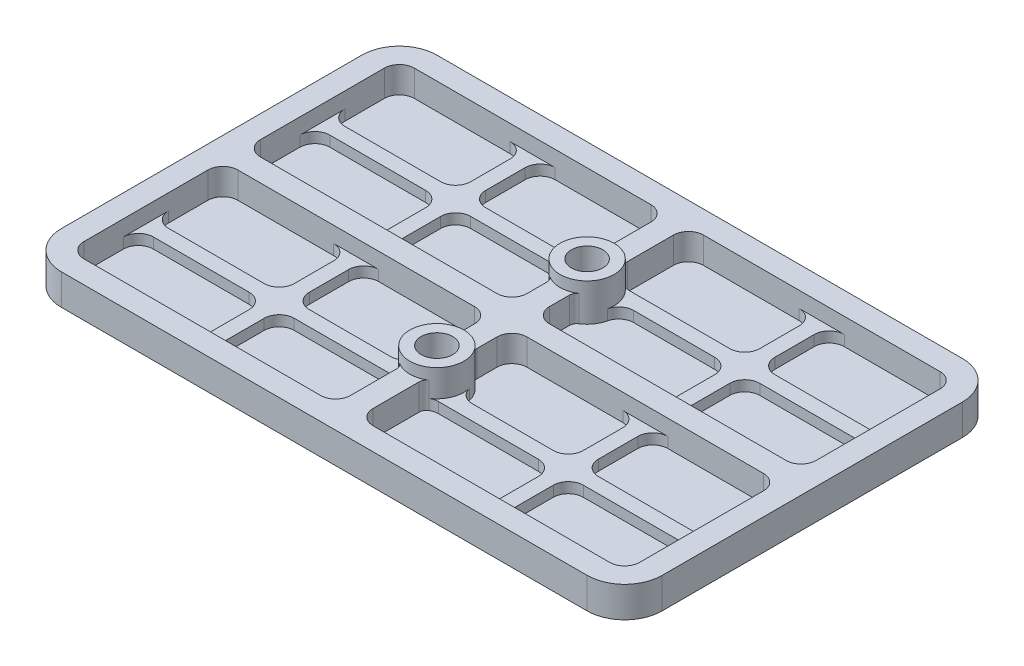
from build123d import *

# Parameters (mm, degrees)
SKETCH1_W           = 80
SKETCH1_H           = 50
BOSS_EXTRUDE1_DEPTH = 0.6
SKETCH2_W           = 80
SKETCH2_H           = 50
SKETCH2_W_2         = 35.5
SKETCH2_H_2         = 20.5
BOSS_EXTRUDE2_DEPTH = 3.5
FILLET1_R           = 2
FILLET2_R           = 5
BOSS_EXTRUDE3_DEPTH = 3.5
SKETCH5_R           = 2.1
CUT_EXTRUDE1_DEPTH  = 5
BOSS_EXTRUDE4_START = 1.5
SKETCH6_R           = 3.6
SKETCH6_R_2         = 2.1
BOSS_EXTRUDE4_DEPTH = 1.5
BOSS_EXTRUDE5_START = 1.4
BOSS_EXTRUDE5_DEPTH = 1.4
FILLET3_DEPTH       = 2
BOSS_EXTRUDE6_START = -0.2
SKETCH8_R           = 2.1
BOSS_EXTRUDE6_DEPTH = 0.2


with BuildPart() as part:
    # Sketch1 → Boss-Extrude1 (new body)
    with BuildSketch(Plane(origin=(0, 0, 0), x_dir=(1, 0, 0), z_dir=(0, 1, 0))):
        Rectangle(SKETCH1_W, SKETCH1_H)
    extrude(amount=BOSS_EXTRUDE1_DEPTH)

    # Sketch2 → Boss-Extrude2 (add)
    with BuildSketch(Plane(origin=(0, 0.6, 0), x_dir=(1, 0, 0), z_dir=(0, 1, 0))):
        Rectangle(SKETCH2_W, SKETCH2_H)
        with Locations((-19.25, 11.75)):
            Rectangle(SKETCH2_W_2, SKETCH2_H_2, mode=Mode.SUBTRACT)
        with Locations((19.25, 11.75)):
            Rectangle(SKETCH2_W_2, SKETCH2_H_2, mode=Mode.SUBTRACT)
        with Locations((19.25, -11.75)):
            Rectangle(SKETCH2_W_2, SKETCH2_H_2, mode=Mode.SUBTRACT)
        with Locations((-19.25, -11.75)):
            Rectangle(SKETCH2_W_2, SKETCH2_H_2, mode=Mode.SUBTRACT)
    extrude(amount=BOSS_EXTRUDE2_DEPTH)

    # Fillet1
    fillet1_edges = [part.edges().sort_by_distance(p)[0] for p in [
        (-37, 2.35, -1.5),
        (-1.5, 2.35, -1.5),
        (-1.5, 2.35, -22),
        (-37, 2.35, -22),
        (1.5, 2.35, -1.5),
        (37, 2.35, -1.5),
        (37, 2.35, -22),
        (1.5, 2.35, -22),
        (37, 2.35, 1.5),
        (1.5, 2.35, 1.5),
        (1.5, 2.35, 22),
        (37, 2.35, 22),
        (-1.5, 2.35, 1.5),
        (-37, 2.35, 1.5),
        (-37, 2.35, 22),
        (-1.5, 2.35, 22),
    ]]
    fillet(fillet1_edges, radius=FILLET1_R)

    # Fillet2
    fillet2_edges = [part.edges().sort_by_distance(p)[0] for p in [
        (-40, 2.05, -25),
        (40, 2.05, -25),
        (40, 2.05, 25),
        (-40, 2.05, 25),
    ]]
    fillet(fillet2_edges, radius=FILLET2_R)

    # Sketch4 → Boss-Extrude3 (add)
    with BuildSketch(Plane(origin=(0, 4.1, 0), x_dir=(1, 0, 0), z_dir=(0, 1, 0))):
        with BuildLine():
            Line((-1.5, 13.861346915), (-1.5, 6.138653085))
            ThreePointArc((-1.5, 6.138653085), (-1.621513159, 6.616419628), (-1.956521739, 6.978076327))
            ThreePointArc((-1.956521739, 6.978076327), (-3.6, 10), (-1.956521739, 13.021923673))
            ThreePointArc((-1.956521739, 13.021923673), (-1.621513159, 13.383580372), (-1.5, 13.861346915))
        make_face()
        with BuildLine():
            Line((1.5, 13.861346915), (1.5, 6.138653085))
            ThreePointArc((1.5, 6.138653085), (1.621513159, 6.616419628), (1.956521739, 6.978076327))
            ThreePointArc((1.956521739, 6.978076327), (3.6, 10), (1.956521739, 13.021923673))
            ThreePointArc((1.956521739, 13.021923673), (1.621513159, 13.383580372), (1.5, 13.861346915))
        make_face()
        with BuildLine():
            Line((1.5, -13.861346915), (1.5, -6.138653085))
            ThreePointArc((1.5, -6.138653085), (1.621513159, -6.616419628), (1.956521739, -6.978076327))
            ThreePointArc((1.956521739, -6.978076327), (3.6, -10), (1.956521739, -13.021923673))
            ThreePointArc((1.956521739, -13.021923673), (1.621513159, -13.383580372), (1.5, -13.861346915))
        make_face()
        with BuildLine():
            Line((-1.5, -13.861346915), (-1.5, -6.138653085))
            ThreePointArc((-1.5, -6.138653085), (-1.621513159, -6.616419628), (-1.956521739, -6.978076327))
            ThreePointArc((-1.956521739, -6.978076327), (-3.6, -10), (-1.956521739, -13.021923673))
            ThreePointArc((-1.956521739, -13.021923673), (-1.621513159, -13.383580372), (-1.5, -13.861346915))
        make_face()
    extrude(amount=-BOSS_EXTRUDE3_DEPTH)

    # Sketch5 → Cut-Extrude1 (cut)
    with BuildSketch(Plane(origin=(0, 4.1, 0), x_dir=(1, 0, 0), z_dir=(0, 1, 0))):
        with Locations(Location((0, 10, 0), (0, 0, 270))):
            Circle(SKETCH5_R)
        with Locations(Location((0, -10, 0), (0, 0, 270))):
            Circle(SKETCH5_R)
    extrude(amount=-CUT_EXTRUDE1_DEPTH, mode=Mode.SUBTRACT)

    # Sketch6 → Boss-Extrude4 (add)
    # profile 1 of 2: a face of its own
    with BuildSketch(Plane(origin=(0, 4.1, 0), x_dir=(1, 0, 0), z_dir=(0, 1, 0)).offset(BOSS_EXTRUDE4_START)):
        with Locations(Location((0, 10, 0), (0, 0, 270))):
            Circle(SKETCH6_R)
        with Locations(Location((0, 10, 0), (0, 0, 270))):
            Circle(SKETCH6_R_2, mode=Mode.SUBTRACT)
    # profile 2 of 2: a face of its own
    with BuildSketch(Plane(origin=(0, 4.1, 0), x_dir=(1, 0, 0), z_dir=(0, 1, 0)).offset(BOSS_EXTRUDE4_START)):
        with Locations(Location((0, -10, 0), (0, 0, 270))):
            Circle(SKETCH6_R)
        with Locations(Location((0, -10, 0), (0, 0, 270))):
            Circle(SKETCH6_R_2, mode=Mode.SUBTRACT)
    extrude(amount=-BOSS_EXTRUDE4_DEPTH)

    # Sketch7 → Boss-Extrude5 (add)
    with BuildSketch(Plane(origin=(0, 0.6, 0), x_dir=(1, 0, 0), z_dir=(0, 1, 0)).offset(BOSS_EXTRUDE5_START)):
        with BuildLine():
            Line((18.25, -1.5), (20.25, -1.5))
            Line((20.25, -1.5), (20.25, -10.75))
            Line((20.25, -10.75), (37, -10.75))
            Line((37, -10.75), (37, -12.75))
            Line((37, -12.75), (20.25, -12.75))
            Line((20.25, -12.75), (20.25, -22))
            Line((20.25, -22), (18.25, -22))
            Line((18.25, -22), (18.25, -12.75))
            Line((18.25, -12.75), (2.323252031, -12.75))
            ThreePointArc((2.323252031, -12.75), (3.088502053, -11.849636469), (3.521008378, -10.75))
            Line((3.521008378, -10.75), (18.25, -10.75))
            Line((18.25, -10.75), (18.25, -1.5))
        make_face()
        with BuildLine():
            Line((3.521008378, 10.75), (18.25, 10.75))
            Line((18.25, 10.75), (18.25, 1.5))
            Line((18.25, 1.5), (20.25, 1.5))
            Line((20.25, 1.5), (20.25, 10.75))
            Line((20.25, 10.75), (37, 10.75))
            Line((37, 10.75), (37, 12.75))
            Line((37, 12.75), (20.25, 12.75))
            Line((20.25, 12.75), (20.25, 22))
            Line((20.25, 22), (18.25, 22))
            Line((18.25, 22), (18.25, 12.75))
            Line((18.25, 12.75), (2.323252031, 12.75))
            ThreePointArc((2.323252031, 12.75), (3.088502053, 11.849636469), (3.521008378, 10.75))
        make_face()
        with BuildLine():
            Line((-18.25, 12.75), (-2.323252031, 12.75))
            ThreePointArc((-2.323252031, 12.75), (-3.088502053, 11.849636469), (-3.521008378, 10.75))
            Line((-3.521008378, 10.75), (-18.25, 10.75))
            Line((-18.25, 10.75), (-18.25, 1.5))
            Line((-18.25, 1.5), (-20.25, 1.5))
            Line((-20.25, 1.5), (-20.25, 10.75))
            Line((-20.25, 10.75), (-37, 10.75))
            Line((-37, 10.75), (-37, 12.75))
            Line((-37, 12.75), (-20.25, 12.75))
            Line((-20.25, 12.75), (-20.25, 22))
            Line((-20.25, 22), (-18.25, 22))
            Line((-18.25, 22), (-18.25, 12.75))
        make_face()
        with BuildLine():
            Line((-3.521008378, -10.75), (-18.25, -10.75))
            Line((-18.25, -10.75), (-18.25, -1.5))
            Line((-18.25, -1.5), (-20.25, -1.5))
            Line((-20.25, -1.5), (-20.25, -10.75))
            Line((-20.25, -10.75), (-37, -10.75))
            Line((-37, -10.75), (-37, -12.75))
            Line((-37, -12.75), (-20.25, -12.75))
            Line((-20.25, -12.75), (-20.25, -22))
            Line((-20.25, -22), (-18.25, -22))
            Line((-18.25, -22), (-18.25, -12.75))
            Line((-18.25, -12.75), (-2.323252031, -12.75))
            ThreePointArc((-2.323252031, -12.75), (-3.088502053, -11.849636469), (-3.521008378, -10.75))
        make_face()
    extrude(amount=-BOSS_EXTRUDE5_DEPTH)

    # Fillet3: read off the stored shape, not the designer's step
    # Fillet3 outline → Fillet3 (add)
    with BuildSketch(Plane(origin=(0, 0, 0), x_dir=(1, 0, 0), z_dir=(0, 1, 0))):
        with BuildLine():
            ThreePointArc((2.963374364, 12.75), (2.441911352, 12.819177293), (1.956521739, 13.021923673))
            ThreePointArc((1.956521739, 13.021923673), (2.144201833, 12.891781198), (2.323252031, 12.75))
            Line((2.323252031, 12.75), (2.963374364, 12.75))
        make_face()
        with BuildLine():
            ThreePointArc((-2.323252031, 12.75), (-2.144201833, 12.891781198), (-1.956521739, 13.021923673))
            ThreePointArc((-1.956521739, 13.021923673), (-2.441911352, 12.819177293), (-2.963374364, 12.75))
            Line((-2.963374364, 12.75), (-2.323252031, 12.75))
        make_face()
        with BuildLine():
            ThreePointArc((18.25, 14.75), (17.664213562, 13.335786438), (16.25, 12.75))
            Line((16.25, 12.75), (18.25, 12.75))
            Line((18.25, 12.75), (18.25, 14.75))
        make_face()
        with BuildLine():
            Line((5.458708638, 10.75), (3.521008378, 10.75))
            ThreePointArc((3.521008378, 10.75), (3.599895483, 9.972568043), (3.509169839, 9.196428571))
            ThreePointArc((3.509169839, 9.196428571), (4.212285184, 10.314106317), (5.458708638, 10.75))
        make_face()
        with BuildLine():
            Line((-18.25, 12.75), (-16.25, 12.75))
            ThreePointArc((-16.25, 12.75), (-17.664213562, 13.335786438), (-18.25, 14.75))
            Line((-18.25, 14.75), (-18.25, 12.75))
        make_face()
        with BuildLine():
            ThreePointArc((-3.509169839, 9.196428571), (-3.599895483, 9.972568043), (-3.521008378, 10.75))
            Line((-3.521008378, 10.75), (-5.458708638, 10.75))
            ThreePointArc((-5.458708638, 10.75), (-4.212285184, 10.314106317), (-3.509169839, 9.196428571))
        make_face()
        with BuildLine():
            ThreePointArc((16.25, 22), (17.664213562, 21.414213562), (18.25, 20))
            Line((18.25, 20), (18.25, 22))
            Line((18.25, 22), (16.25, 22))
        make_face()
        with BuildLine():
            Line((18.25, 10.75), (16.25, 10.75))
            ThreePointArc((16.25, 10.75), (17.664213562, 10.164213562), (18.25, 8.75))
            Line((18.25, 8.75), (18.25, 10.75))
        make_face()
        with BuildLine():
            Line((-18.25, 22), (-18.25, 20))
            ThreePointArc((-18.25, 20), (-17.664213562, 21.414213562), (-16.25, 22))
            Line((-16.25, 22), (-18.25, 22))
        make_face()
        with BuildLine():
            ThreePointArc((-18.25, 8.75), (-17.664213562, 10.164213562), (-16.25, 10.75))
            Line((-16.25, 10.75), (-18.25, 10.75))
            Line((-18.25, 10.75), (-18.25, 8.75))
        make_face()
        with BuildLine():
            Line((22.25, 22), (20.25, 22))
            Line((20.25, 22), (20.25, 20))
            ThreePointArc((20.25, 20), (20.835786438, 21.414213562), (22.25, 22))
        make_face()
        with BuildLine():
            Line((18.25, 1.5), (18.25, 3.5))
            ThreePointArc((18.25, 3.5), (17.664213562, 2.085786438), (16.25, 1.5))
            Line((16.25, 1.5), (18.25, 1.5))
        make_face()
        with BuildLine():
            Line((-20.25, 20), (-20.25, 22))
            Line((-20.25, 22), (-22.25, 22))
            ThreePointArc((-22.25, 22), (-20.835786438, 21.414213562), (-20.25, 20))
        make_face()
        with BuildLine():
            ThreePointArc((-16.25, 1.5), (-17.664213562, 2.085786438), (-18.25, 3.5))
            Line((-18.25, 3.5), (-18.25, 1.5))
            Line((-18.25, 1.5), (-16.25, 1.5))
        make_face()
        with BuildLine():
            ThreePointArc((22.25, 12.75), (20.835786438, 13.335786438), (20.25, 14.75))
            Line((20.25, 14.75), (20.25, 12.75))
            Line((20.25, 12.75), (22.25, 12.75))
        make_face()
        with BuildLine():
            Line((20.25, 3.5), (20.25, 1.5))
            Line((20.25, 1.5), (22.25, 1.5))
            ThreePointArc((22.25, 1.5), (20.835786438, 2.085786438), (20.25, 3.5))
        make_face()
        with BuildLine():
            Line((-20.25, 12.75), (-20.25, 14.75))
            ThreePointArc((-20.25, 14.75), (-20.835786438, 13.335786438), (-22.25, 12.75))
            Line((-22.25, 12.75), (-20.25, 12.75))
        make_face()
        with BuildLine():
            Line((-22.25, 1.5), (-20.25, 1.5))
            Line((-20.25, 1.5), (-20.25, 3.5))
            ThreePointArc((-20.25, 3.5), (-20.835786438, 2.085786438), (-22.25, 1.5))
        make_face()
        with BuildLine():
            ThreePointArc((37, 14.75), (36.414213562, 13.335786438), (35, 12.75))
            Line((35, 12.75), (37, 12.75))
            Line((37, 12.75), (37, 14.75))
        make_face()
        with BuildLine():
            Line((20.25, 10.75), (20.25, 8.75))
            ThreePointArc((20.25, 8.75), (20.835786438, 10.164213562), (22.25, 10.75))
            Line((22.25, 10.75), (20.25, 10.75))
        make_face()
        with BuildLine():
            Line((-37, 12.75), (-35, 12.75))
            ThreePointArc((-35, 12.75), (-36.414213562, 13.335786438), (-37, 14.75))
            Line((-37, 14.75), (-37, 12.75))
        make_face()
        with BuildLine():
            ThreePointArc((-22.25, 10.75), (-20.835786438, 10.164213562), (-20.25, 8.75))
            Line((-20.25, 8.75), (-20.25, 10.75))
            Line((-20.25, 10.75), (-22.25, 10.75))
        make_face()
        with BuildLine():
            Line((37, 8.75), (37, 10.75))
            Line((37, 10.75), (35, 10.75))
            ThreePointArc((35, 10.75), (36.414213562, 10.164213562), (37, 8.75))
        make_face()
        with BuildLine():
            Line((-35, 10.75), (-37, 10.75))
            Line((-37, 10.75), (-37, 8.75))
            ThreePointArc((-37, 8.75), (-36.414213562, 10.164213562), (-35, 10.75))
        make_face()
        with BuildLine():
            Line((18.25, -1.5), (16.25, -1.5))
            ThreePointArc((16.25, -1.5), (17.664213562, -2.085786438), (18.25, -3.5))
            Line((18.25, -3.5), (18.25, -1.5))
        make_face()
        with BuildLine():
            Line((18.25, -10.75), (18.25, -8.75))
            ThreePointArc((18.25, -8.75), (17.664213562, -10.164213562), (16.25, -10.75))
            Line((16.25, -10.75), (18.25, -10.75))
        make_face()
        with BuildLine():
            Line((22.25, -1.5), (20.25, -1.5))
            Line((20.25, -1.5), (20.25, -3.5))
            ThreePointArc((20.25, -3.5), (20.835786438, -2.085786438), (22.25, -1.5))
        make_face()
        with BuildLine():
            Line((3.521008378, -10.75), (5.458708638, -10.75))
            ThreePointArc((5.458708638, -10.75), (4.212285184, -10.314106317), (3.509169839, -9.196428571))
            ThreePointArc((3.509169839, -9.196428571), (3.599895483, -9.972568043), (3.521008378, -10.75))
        make_face()
        with BuildLine():
            ThreePointArc((22.25, -10.75), (20.835786438, -10.164213562), (20.25, -8.75))
            Line((20.25, -8.75), (20.25, -10.75))
            Line((20.25, -10.75), (22.25, -10.75))
        make_face()
        with BuildLine():
            ThreePointArc((-3.521008378, -10.75), (-3.599895483, -9.972568043), (-3.509169839, -9.196428571))
            ThreePointArc((-3.509169839, -9.196428571), (-4.212285184, -10.314106317), (-5.458708638, -10.75))
            Line((-5.458708638, -10.75), (-3.521008378, -10.75))
        make_face()
        with BuildLine():
            Line((2.963374364, -12.75), (2.323252031, -12.75))
            ThreePointArc((2.323252031, -12.75), (2.144201833, -12.891781198), (1.956521739, -13.021923673))
            ThreePointArc((1.956521739, -13.021923673), (2.441911352, -12.819177293), (2.963374364, -12.75))
        make_face()
        with BuildLine():
            ThreePointArc((37, -8.75), (36.414213562, -10.164213562), (35, -10.75))
            Line((35, -10.75), (37, -10.75))
            Line((37, -10.75), (37, -8.75))
        make_face()
        with BuildLine():
            Line((-18.25, -10.75), (-16.25, -10.75))
            ThreePointArc((-16.25, -10.75), (-17.664213562, -10.164213562), (-18.25, -8.75))
            Line((-18.25, -8.75), (-18.25, -10.75))
        make_face()
        with BuildLine():
            ThreePointArc((-1.956521739, -13.021923673), (-2.144201833, -12.891781198), (-2.323252031, -12.75))
            Line((-2.323252031, -12.75), (-2.963374364, -12.75))
            ThreePointArc((-2.963374364, -12.75), (-2.441911352, -12.819177293), (-1.956521739, -13.021923673))
        make_face()
        with BuildLine():
            Line((18.25, -12.75), (16.25, -12.75))
            ThreePointArc((16.25, -12.75), (17.664213562, -13.335786438), (18.25, -14.75))
            Line((18.25, -14.75), (18.25, -12.75))
        make_face()
        with BuildLine():
            Line((37, -14.75), (37, -12.75))
            Line((37, -12.75), (35, -12.75))
            ThreePointArc((35, -12.75), (36.414213562, -13.335786438), (37, -14.75))
        make_face()
        with BuildLine():
            Line((-18.25, -1.5), (-18.25, -3.5))
            ThreePointArc((-18.25, -3.5), (-17.664213562, -2.085786438), (-16.25, -1.5))
            Line((-16.25, -1.5), (-18.25, -1.5))
        make_face()
        with BuildLine():
            ThreePointArc((-18.25, -14.75), (-17.664213562, -13.335786438), (-16.25, -12.75))
            Line((-16.25, -12.75), (-18.25, -12.75))
            Line((-18.25, -12.75), (-18.25, -14.75))
        make_face()
        with BuildLine():
            Line((18.25, -22), (18.25, -20))
            ThreePointArc((18.25, -20), (17.664213562, -21.414213562), (16.25, -22))
            Line((16.25, -22), (18.25, -22))
        make_face()
        with BuildLine():
            ThreePointArc((20.25, -14.75), (20.835786438, -13.335786438), (22.25, -12.75))
            Line((22.25, -12.75), (20.25, -12.75))
            Line((20.25, -12.75), (20.25, -14.75))
        make_face()
        with BuildLine():
            Line((-20.25, -3.5), (-20.25, -1.5))
            Line((-20.25, -1.5), (-22.25, -1.5))
            ThreePointArc((-22.25, -1.5), (-20.835786438, -2.085786438), (-20.25, -3.5))
        make_face()
        with BuildLine():
            ThreePointArc((-16.25, -22), (-17.664213562, -21.414213562), (-18.25, -20))
            Line((-18.25, -20), (-18.25, -22))
            Line((-18.25, -22), (-16.25, -22))
        make_face()
        with BuildLine():
            Line((20.25, -20), (20.25, -22))
            Line((20.25, -22), (22.25, -22))
            ThreePointArc((22.25, -22), (20.835786438, -21.414213562), (20.25, -20))
        make_face()
        with BuildLine():
            Line((-20.25, -10.75), (-20.25, -8.75))
            ThreePointArc((-20.25, -8.75), (-20.835786438, -10.164213562), (-22.25, -10.75))
            Line((-22.25, -10.75), (-20.25, -10.75))
        make_face()
        with BuildLine():
            Line((-22.25, -22), (-20.25, -22))
            Line((-20.25, -22), (-20.25, -20))
            ThreePointArc((-20.25, -20), (-20.835786438, -21.414213562), (-22.25, -22))
        make_face()
        with BuildLine():
            Line((-37, -10.75), (-35, -10.75))
            ThreePointArc((-35, -10.75), (-36.414213562, -10.164213562), (-37, -8.75))
            Line((-37, -8.75), (-37, -10.75))
        make_face()
        with BuildLine():
            ThreePointArc((-22.25, -12.75), (-20.835786438, -13.335786438), (-20.25, -14.75))
            Line((-20.25, -14.75), (-20.25, -12.75))
            Line((-20.25, -12.75), (-22.25, -12.75))
        make_face()
        with BuildLine():
            Line((-35, -12.75), (-37, -12.75))
            Line((-37, -12.75), (-37, -14.75))
            ThreePointArc((-37, -14.75), (-36.414213562, -13.335786438), (-35, -12.75))
        make_face()
    extrude(amount=FILLET3_DEPTH)

    # Sketch8 → Boss-Extrude6 (add)
    with BuildSketch(Plane.XZ.offset(BOSS_EXTRUDE6_START)):
        with Locations(Location((0, 10, 0), (0, 0, 90))):
            Circle(SKETCH8_R)
        with Locations(Location((0, -10, 0), (0, 0, 90))):
            Circle(SKETCH8_R)
    extrude(amount=BOSS_EXTRUDE6_DEPTH)


solid = part.part
